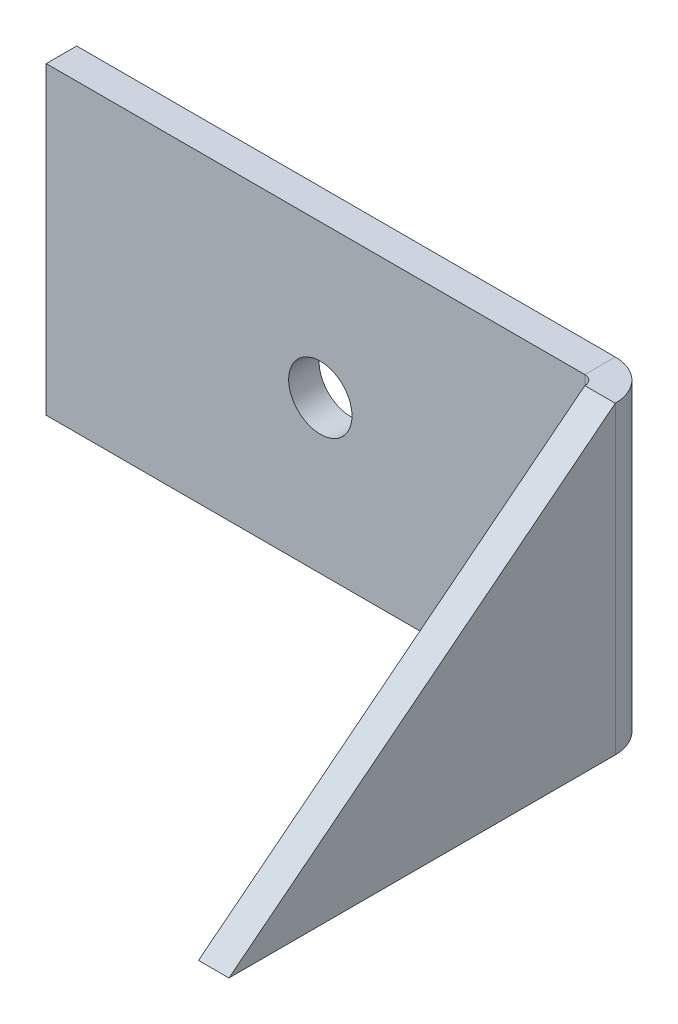
from build123d import *

# Parameters (mm, degrees)
SKETCH2_W                    = 57.15
SKETCH2_H                    = 31.75
BASE_FLANGE1_DEPTH           = 3.175
EDGE_FLANGE1_STRIP_W         = 14.7
EDGE_FLANGE1_STRIP_H         = 3.175
EDGE_FLANGE1_STRIP_CUT_DEPTH = 31.75
EDGE_FLANGE1_DEPTH           = 31.75
CUT_EXTRUDE1_DEPTH           = 77.59584682
CUT_EXTRUDE1_DEPTH_BACK      = 3.175
M6_CLEARANCE_HOLE1_D         = 6.6


# Sheet-metal steps are written as plain solids
with BuildPart() as part:
    # Sketch2 → Base-Flange1 (new body)
    with BuildSketch(Plane.XY):
        Rectangle(SKETCH2_W, SKETCH2_H)
    extrude(amount=BASE_FLANGE1_DEPTH)

    # Edge-Flange1 strip (across the edge) → Edge-Flange1 strip cut (cut)
    with BuildSketch(Plane(origin=(28.575, -15.875, 3.175), x_dir=(-1, 0, 0), z_dir=(0, 1, 0))):
        with Locations((-6.35, -1.5875)):
            Rectangle(EDGE_FLANGE1_STRIP_W, EDGE_FLANGE1_STRIP_H)
    extrude(amount=EDGE_FLANGE1_STRIP_CUT_DEPTH, mode=Mode.SUBTRACT)

    # Edge-Flange1 section (across the edge) → Edge-Flange1 (add)
    with BuildSketch(Plane(origin=(28.575, -15.875, 3.175), x_dir=(-1, 0, 0), z_dir=(0, 1, 0))):
        with BuildLine():
            Line((-3.175, 1), (-3.175, 41.275))
            Line((-3.175, 41.275), (0, 41.275))
            Line((0, 41.275), (0, 1))
            ThreePointArc((0, 1), (0.292893219, 0.292893219), (1, 0))
            Line((1, 0), (1, -3.175))
            ThreePointArc((1, -3.175), (-1.952170811, -1.952170811), (-3.175, 1))
        make_face()
    extrude(amount=EDGE_FLANGE1_DEPTH)

    # Sketch10 → Cut-Extrude1 (cut, two sides: drawn at the far end of the back side and taken through both)
    with BuildSketch(Plane(origin=(31.75, 0, 0), x_dir=(0, 0, -1), z_dir=(1, 0, 0)).offset(-CUT_EXTRUDE1_DEPTH_BACK)):
        Polygon((-4.175, 15.875), (-44.45, -15.875), (-44.45, 15.875), align=None)
    extrude(amount=CUT_EXTRUDE1_DEPTH + CUT_EXTRUDE1_DEPTH_BACK, mode=Mode.SUBTRACT)

    # M6 Clearance Hole1 (through all)
    with Locations(Plane.XY.offset(3.175)):
        with Locations((0, 0)):
            Hole(M6_CLEARANCE_HOLE1_D / 2)


solid = part.part
